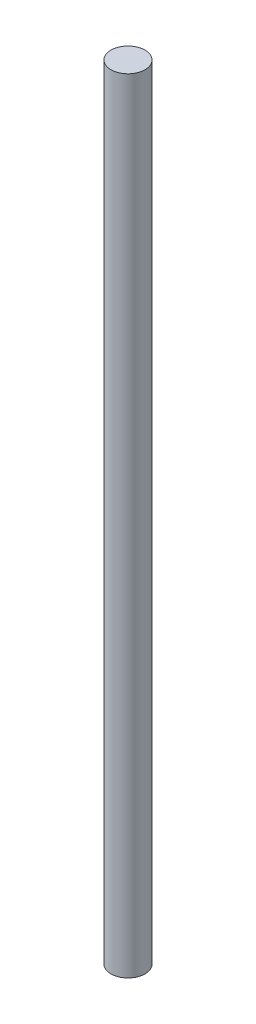
from build123d import *

# Parameters (mm, degrees)
SKETCH1_R           = 3
BOSS_EXTRUDE1_DEPTH = 138


with BuildPart() as part:
    # Sketch1 → Boss-Extrude1 (new body)
    with BuildSketch(Plane(origin=(0, 0, 0), x_dir=(1, 0, 0), z_dir=(0, 1, 0))):
        Circle(SKETCH1_R)
    extrude(amount=BOSS_EXTRUDE1_DEPTH)


solid = part.part
